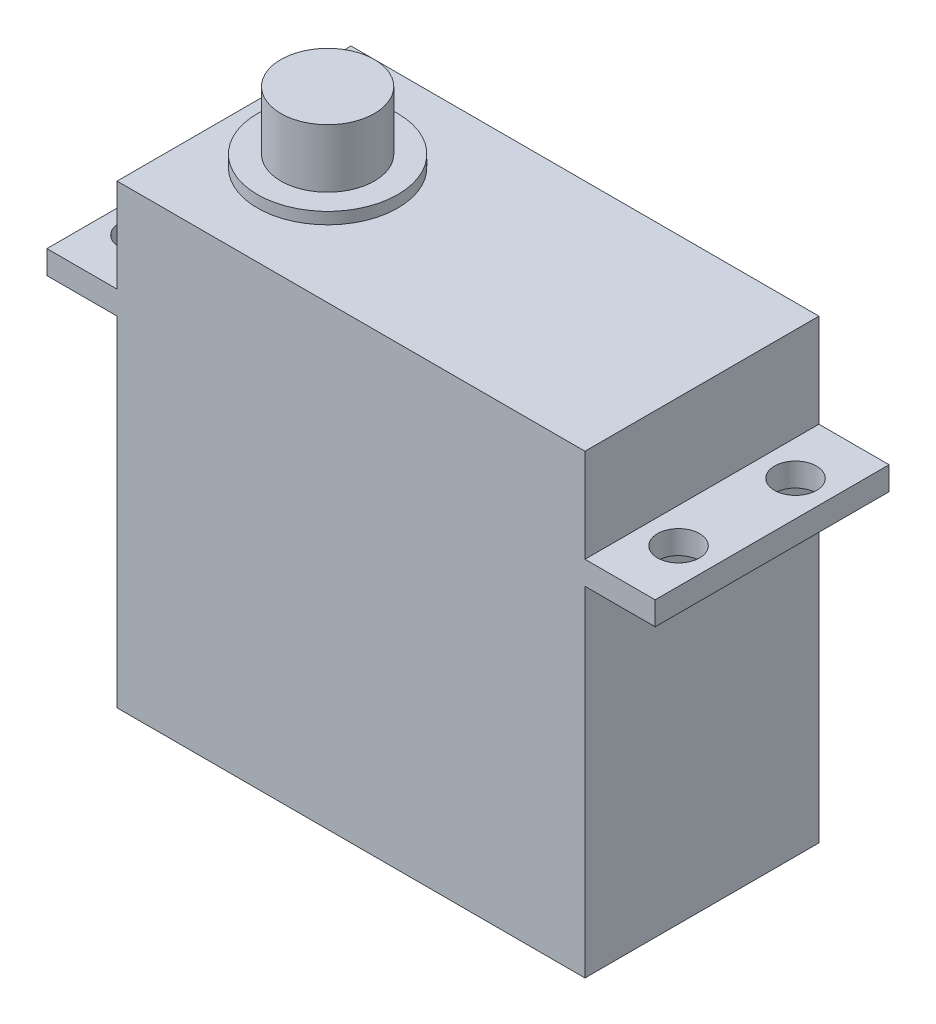
from build123d import *

# Parameters (mm, degrees)
SKETCH_1_W          = 40
SKETCH_1_H          = 39
EXTRUDE_1_DEPTH     = 20
SKETCH_2_R          = 6
EXTRUDE_2_DEPTH     = 1
SKETCH_3_R          = 4
EXTRUDE_3_DEPTH     = 5
SKETCH_4_W          = 20
SKETCH_4_H          = 2
EXTRUDE_4_DEPTH     = 6
SKETCH_5_R          = 1.8
CUT_EXTRUDE_1_DEPTH = 6
SKETCH_8_W          = 20
SKETCH_8_H          = 2
EXTRUDE_5_DEPTH     = 6
SKETCH_9_R          = 1.8
CUT_EXTRUDE_2_DEPTH = 6


with BuildPart() as part:
    # 草图1 → 凸台-拉伸1 (new body)
    with BuildSketch(Plane.XY):
        with Locations((20, 19.5)):
            Rectangle(SKETCH_1_W, SKETCH_1_H)
    extrude(amount=EXTRUDE_1_DEPTH)

    # 草图2 → 凸台-拉伸2 (add)
    with BuildSketch(Plane(origin=(0, 39, 0), x_dir=(1, 0, 0), z_dir=(0, 1, 0))):
        with Locations((8, -10)):
            Circle(SKETCH_2_R)
    extrude(amount=EXTRUDE_2_DEPTH)

    # 草图3 → 凸台-拉伸3 (add)
    with BuildSketch(Plane(origin=(0, 40, 0), x_dir=(1, 0, 0), z_dir=(0, 1, 0))):
        with Locations((8, -10)):
            Circle(SKETCH_3_R)
    extrude(amount=EXTRUDE_3_DEPTH)

    # 草图4 → 凸台-拉伸4 (add)
    with BuildSketch(Plane.ZY):
        with Locations((10, 30)):
            Rectangle(SKETCH_4_W, SKETCH_4_H)
    extrude(amount=EXTRUDE_4_DEPTH)

    # 草图5 → 切除-拉伸1 (cut)
    with BuildSketch(Plane(origin=(0, 31, 0), x_dir=(1, 0, 0), z_dir=(0, 1, 0))):
        with Locations((-3, -5)):
            Circle(SKETCH_5_R)
        with Locations((-3, -15)):
            Circle(SKETCH_5_R)
    extrude(amount=-CUT_EXTRUDE_1_DEPTH, mode=Mode.SUBTRACT)

    # 草图8 → 凸台-拉伸5 (add)
    with BuildSketch(Plane(origin=(40, 0, 0), x_dir=(0, 0, -1), z_dir=(1, 0, 0))):
        with Locations((-10, 30)):
            Rectangle(SKETCH_8_W, SKETCH_8_H)
    extrude(amount=EXTRUDE_5_DEPTH)

    # 草图9 → 切除-拉伸2 (cut)
    with BuildSketch(Plane(origin=(0, 31, 0), x_dir=(1, 0, 0), z_dir=(0, 1, 0))):
        with Locations((43, -5)):
            Circle(SKETCH_9_R)
        with Locations((43, -15)):
            Circle(SKETCH_9_R)
    extrude(amount=-CUT_EXTRUDE_2_DEPTH, mode=Mode.SUBTRACT)


solid = part.part
